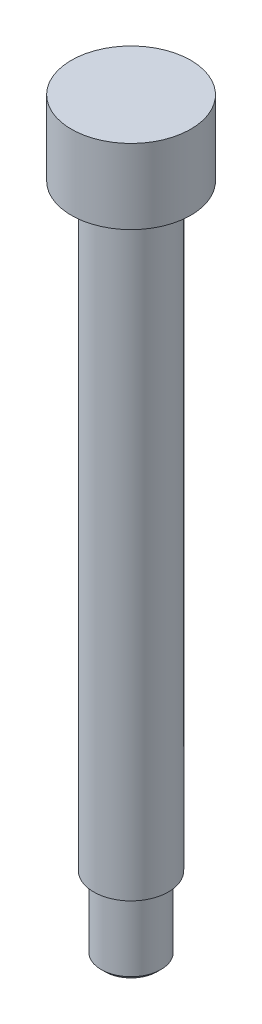
from build123d import *

# Parameters (mm, degrees)
CHAMFER1_SIZE = 0.5


with BuildPart() as part:
    # Sketch1 → Revolve1 (revolve)
    with BuildSketch(Plane.XY):
        Polygon((0, 0), (8, 0), (8, -10), (5, -10), (5, -90), (4, -90), (4, -100), (0, -100), align=None)
    revolve(axis=Axis((0, -105, 0), (0, 1, 0)))

    # Chamfer1
    chamfer1_edges = [part.edges().sort_by_distance(p)[0] for p in [
        (-4, -100, 0),
    ]]
    chamfer(chamfer1_edges, length=CHAMFER1_SIZE)


solid = part.part
